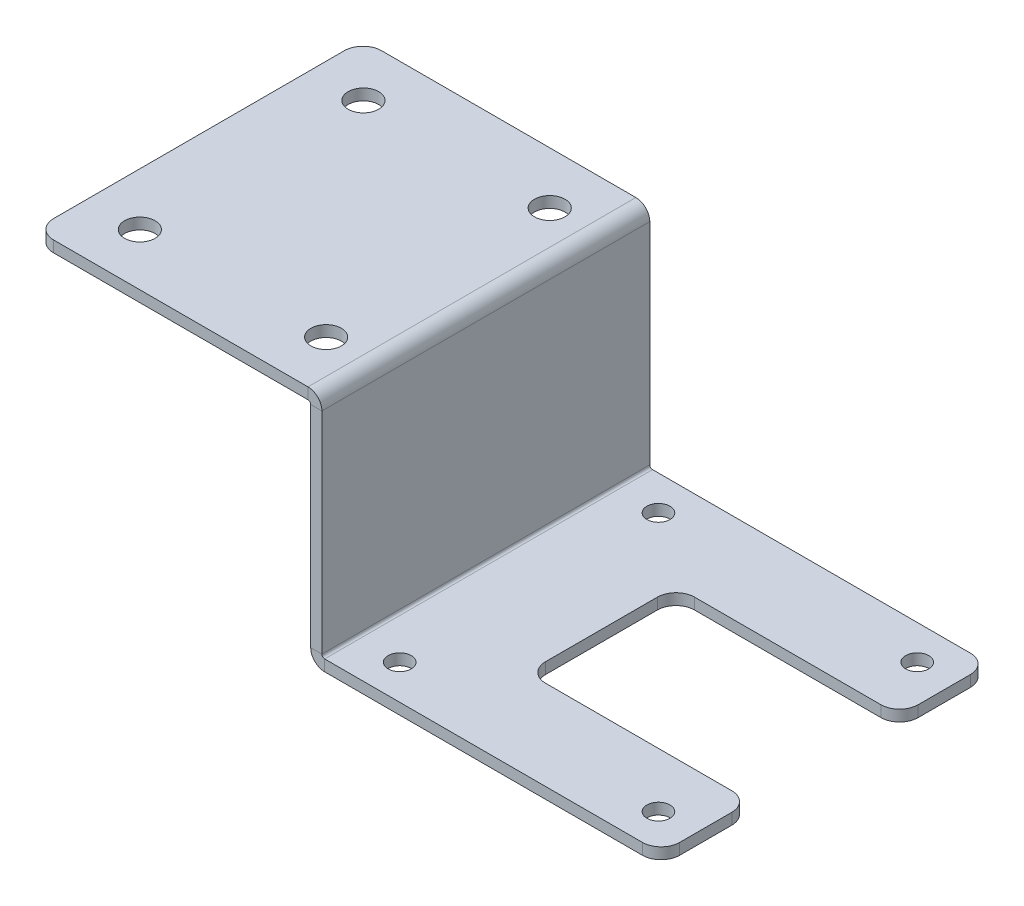
from build123d import *

# Parameters (mm, degrees)
SZKIC1_W                       = 168
SZKIC1_H                       = 88
ODGI_CIE_BAZOWE1_DEPTH         = 3
USKOK1_START                   = -44
USKOK1_DEPTH                   = 88
USKOK1_2_DEPTH                 = 88
SZKIC7_W                       = 60
SZKIC7_H                       = 40
WYTNIJ_WYCI_GNI_CIE1_DEPTH     = 113.751940116
ZAOKR_GLENIE1_R                = 5
OTWORY_USTALAJ_CE_6_2MM1_D     = 6.2
OTWORY_USTALAJ_CE_6_2MM1_DEPTH = 27.5
OTWORY_USTALAJ_CE_6_2MM1_TIP   = 1.862667919
OTWORY_USTALAJ_CE_8_0MM2_D     = 8.2
OTWORY_USTALAJ_CE_8_0MM2_DEPTH = 27.5
OTWORY_USTALAJ_CE_8_0MM2_TIP   = 2.463528538


# Read off the part's stored shape, not the designer's step: Uskok1
# Sheet-metal steps are written as plain solids
with BuildPart() as part:
    # Szkic1 → Odgięcie bazowe1 (new body)
    with BuildSketch(Plane(origin=(0, 0, 0), x_dir=(1, 0, 0), z_dir=(0, 1, 0))):
        Rectangle(SZKIC1_W, SZKIC1_H)
    extrude(amount=-ODGI_CIE_BAZOWE1_DEPTH)

    # Uskok1 outline → Uskok1 (cut)
    with BuildSketch(Plane.XY.offset(USKOK1_START)):
        with BuildLine():
            ThreePointArc((-10.756621532, 0), (-8.389154531, -0.845704021), (-7.093344311, -3))
            Line((-7.093344311, -3), (84, -3))
            Line((84, -3), (84, 0))
            Line((84, 0), (-10.756621532, 0))
        make_face()
    extrude(amount=USKOK1_DEPTH, mode=Mode.SUBTRACT)

    # Uskok1 2 outline → Uskok1 2 (add)
    with BuildSketch(Plane.XY.offset(USKOK1_START)):
        with BuildLine():
            ThreePointArc((-10.756621532, -3), (-10.235766677, -3.215745145), (-10.020021532, -3.7366))
            Line((-10.020021532, -3.7366), (-10.020021532, -60.2634))
            ThreePointArc((-10.020021532, -60.2634), (-8.925596731, -62.905575199), (-6.283421532, -64))
            Line((-6.283421532, -64), (84, -64))
            Line((84, -64), (84, -61))
            Line((84, -61), (-6.283421532, -61))
            ThreePointArc((-6.283421532, -61), (-6.804276387, -60.784254855), (-7.020021532, -60.2634))
            Line((-7.020021532, -60.2634), (-7.020021532, -3.7366))
            ThreePointArc((-7.020021532, -3.7366), (-7.038397411, -3.36647982), (-7.093344311, -3))
            Line((-7.093344311, -3), (-10.756621532, -3))
        make_face()
    extrude(amount=USKOK1_2_DEPTH)

    # Szkic7 → Wytnij-wyciągnięcie1 (cut, through all)
    with BuildSketch(Plane(origin=(0, -61, 0), x_dir=(1, 0, 0), z_dir=(0, 1, 0))):
        with Locations((54, 0)):
            Rectangle(SZKIC7_W, SZKIC7_H)
    extrude(amount=-WYTNIJ_WYCI_GNI_CIE1_DEPTH, mode=Mode.SUBTRACT)

    # Zaokrąglenie1
    zaokr_glenie1_edges = [part.edges().sort_by_distance(p)[0] for p in [
        (84, -62.5, -44),
        (84, -62.5, 44),
        (84, -62.5, -20),
        (84, -62.5, 20),
        (24, -62.5, 20),
        (24, -62.5, -20),
        (-84, -1.5, 44),
        (-84, -1.5, -44),
    ]]
    fillet(zaokr_glenie1_edges, radius=ZAOKR_GLENIE1_R)

    # Otwory ustalające Ø6.2mm1
    with Locations(Plane(origin=(0, -61, 0), x_dir=(1, 0, 0), z_dir=(0, 1, 0))):
        with Locations((74, 34.742873432), (74, -34.697126568), (4.56, -34.697126568), (4.56, 34.742873432)):
            Hole(OTWORY_USTALAJ_CE_6_2MM1_D / 2, depth=OTWORY_USTALAJ_CE_6_2MM1_DEPTH)
            with Locations((0, 0, -(OTWORY_USTALAJ_CE_6_2MM1_DEPTH + OTWORY_USTALAJ_CE_6_2MM1_TIP / 2))):  # 118° drill point
                Cone(0, OTWORY_USTALAJ_CE_6_2MM1_D / 2, OTWORY_USTALAJ_CE_6_2MM1_TIP, mode=Mode.SUBTRACT)

    # Otwory ustalające Ø8.0mm2
    with Locations(Plane(origin=(0, 0, 0), x_dir=(1, 0, 0), z_dir=(0, 1, 0))):
        with Locations((-69.878310766, 30), (-19.878310766, 30), (-19.878310766, -30), (-69.878310766, -30)):
            Hole(OTWORY_USTALAJ_CE_8_0MM2_D / 2, depth=OTWORY_USTALAJ_CE_8_0MM2_DEPTH)
            with Locations((0, 0, -(OTWORY_USTALAJ_CE_8_0MM2_DEPTH + OTWORY_USTALAJ_CE_8_0MM2_TIP / 2))):  # 118° drill point
                Cone(0, OTWORY_USTALAJ_CE_8_0MM2_D / 2, OTWORY_USTALAJ_CE_8_0MM2_TIP, mode=Mode.SUBTRACT)


solid = part.part
